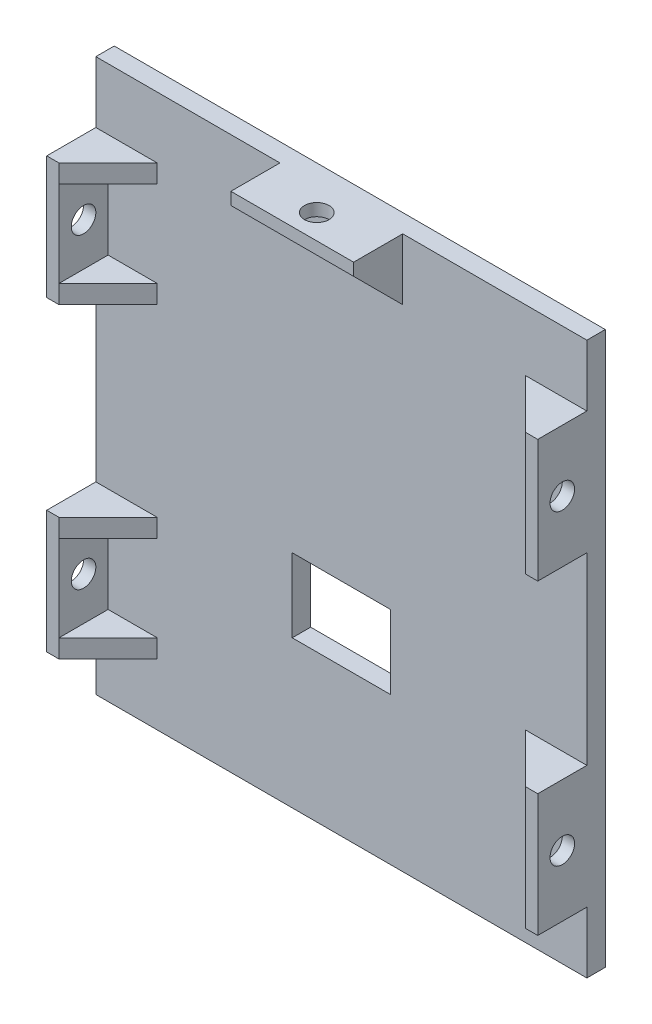
from build123d import *

# Parameters (mm, degrees)
SKETCH1_W               = 80
SKETCH1_H               = 90
BOSS_EXTRUDE1_DEPTH     = 3
BOSS_EXTRUDE2_DEPTH     = 8
CUT_EXTRUDE1_DEPTH      = 114.670576668
SKETCH6_R               = 2
CUT_EXTRUDE3_DEPTH      = 25
MIRROR5_COPY_1_DEPTH    = 8
MIRROR5_COPY_2_DEPTH    = 114.670576668
MIRROR5_COPY_3_SKETCH_R = 2
MIRROR5_COPY_3_DEPTH    = 25
MIRROR5_COPY_4_SKETCH_R = 2
MIRROR5_COPY_4_DEPTH    = 25
BOSS_EXTRUDE3_DEPTH     = 8
CUT_EXTRUDE2_DEPTH      = 25
SKETCH7_R               = 2
CUT_EXTRUDE4_DEPTH      = 25
CUT_EXTRUDE5_DEPTH      = 10


with BuildPart() as part:
    # Sketch1 → Boss-Extrude1 (new body)
    with BuildSketch(Plane.XY):
        with Locations((40, 45)):
            Rectangle(SKETCH1_W, SKETCH1_H)
    extrude(amount=BOSS_EXTRUDE1_DEPTH)

    # Sketch2 → Boss-Extrude2 (add)
    with BuildSketch(Plane.XY.offset(3)):
        Polygon((0, 80), (10, 80), (10, 77), (2, 77), (2, 63), (10, 63), (10, 60), (0, 60), align=None)
    boss_extrude2 = extrude(amount=BOSS_EXTRUDE2_DEPTH)

    # Sketch3 → Cut-Extrude1 (cut, through all)
    with BuildSketch(Plane(origin=(0, 80, 0), x_dir=(1, 0, 0), z_dir=(0, 1, 0))):
        Polygon((10, -3), (2, -11), (10, -11), align=None)
    cut_extrude1 = extrude(amount=-CUT_EXTRUDE1_DEPTH, mode=Mode.SUBTRACT)

    # Sketch6 → Cut-Extrude3 (cut)
    with BuildSketch(Plane(origin=(2, 0, 0), x_dir=(0, 0, -1), z_dir=(1, 0, 0))):
        with Locations((-7, 70)):
            Circle(SKETCH6_R)
    cut_extrude3 = extrude(amount=-CUT_EXTRUDE3_DEPTH, mode=Mode.SUBTRACT)

    # Mirror4: Boss-Extrude2, Cut-Extrude1, Cut-Extrude3 across plane
    add(boss_extrude2.mirror(Plane(origin=(40, 0, 0), x_dir=(0, 0, 1), z_dir=(1, 0, 0))))
    add(cut_extrude1.mirror(Plane(origin=(40, 0, 0), x_dir=(0, 0, 1), z_dir=(1, 0, 0))), mode=Mode.SUBTRACT)
    add(cut_extrude3.mirror(Plane(origin=(40, 0, 0), x_dir=(0, 0, 1), z_dir=(1, 0, 0))), mode=Mode.SUBTRACT)

    # Mirror5: Boss-Extrude2, Cut-Extrude1 across plane
    add(boss_extrude2.mirror(Plane(origin=(0, 45, 0), x_dir=(0, 0, 1), z_dir=(0, -1, 0))))
    add(cut_extrude1.mirror(Plane(origin=(0, 45, 0), x_dir=(0, 0, 1), z_dir=(0, -1, 0))), mode=Mode.SUBTRACT)

    # Mirror5 copy 1 sketch → Mirror5 copy 1 (add)
    with BuildSketch(Plane(origin=(80, 90, 3), x_dir=(-1, 0, 0), z_dir=(0, 0, 1))):
        Polygon((0, 80), (10, 80), (10, 77), (2, 77), (2, 63), (10, 63), (10, 60), (0, 60), align=None)
    extrude(amount=MIRROR5_COPY_1_DEPTH)

    # Mirror5 copy 2 sketch → Mirror5 copy 2 (cut, through all)
    with BuildSketch(Plane(origin=(80, 10, 0), x_dir=(-1, 0, 0), z_dir=(0, -1, 0))):
        Polygon((10, -3), (2, -11), (10, -11), align=None)
    extrude(amount=-MIRROR5_COPY_2_DEPTH, mode=Mode.SUBTRACT)

    # Mirror5 copy 3 sketch → Mirror5 copy 3 (cut)
    with BuildSketch(Plane(origin=(78, 90, 0), x_dir=(0, 0, -1), z_dir=(-1, 0, 0))):
        with Locations((-7, 70)):
            Circle(MIRROR5_COPY_3_SKETCH_R)
    extrude(amount=-MIRROR5_COPY_3_DEPTH, mode=Mode.SUBTRACT)

    # Mirror5 copy 4 sketch → Mirror5 copy 4 (cut)
    with BuildSketch(Plane(origin=(2, 90, 0), x_dir=(0, 0, -1), z_dir=(1, 0, 0))):
        with Locations((-7, -70)):
            Circle(MIRROR5_COPY_4_SKETCH_R)
    extrude(amount=-MIRROR5_COPY_4_DEPTH, mode=Mode.SUBTRACT)

    # Sketch4 → Boss-Extrude3 (add)
    with BuildSketch(Plane.XY.offset(3)):
        Polygon((30, 90), (50, 90), (50, 80), (47, 80), (47, 88), (33, 88), (33, 80), (30, 80), align=None)
    extrude(amount=BOSS_EXTRUDE3_DEPTH)

    # Sketch5 → Cut-Extrude2 (cut)
    with BuildSketch(Plane.ZY.offset(-30)):
        Polygon((3, 80), (11, 88), (11, 80), align=None)
    extrude(amount=-CUT_EXTRUDE2_DEPTH, mode=Mode.SUBTRACT)

    # Sketch7 → Cut-Extrude4 (cut)
    with BuildSketch(Plane.XZ.offset(-88)):
        with Locations((40, 7)):
            Circle(SKETCH7_R)
    extrude(amount=-CUT_EXTRUDE4_DEPTH, mode=Mode.SUBTRACT)

    # Sketch8 → Cut-Extrude5 (cut)
    with BuildSketch(Plane.XY.offset(3)):
        Polygon((40, 36), (32, 36), (32, 24), (48, 24), (48, 36), align=None)
    extrude(amount=-CUT_EXTRUDE5_DEPTH, mode=Mode.SUBTRACT)


solid = part.part
